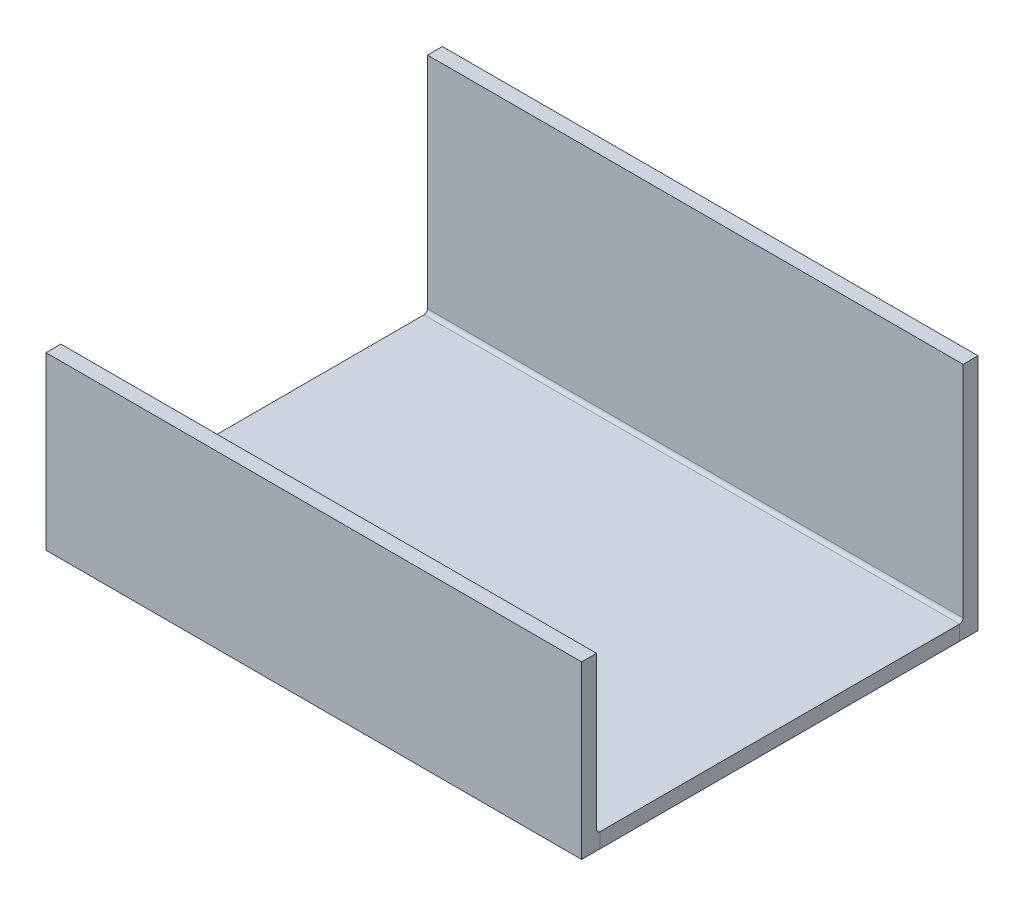
from build123d import *

# Parameters (mm, degrees)
SKETCH1_W                    = 114.3
SKETCH1_H                    = 78.232
BOSS_EXTRUDE1_DEPTH          = 3.175
EDGE_FLANGE1_STRIP_W         = 14.224
EDGE_FLANGE1_STRIP_H         = 3.175
EDGE_FLANGE1_STRIP_CUT_DEPTH = 114.3
EDGE_FLANGE1_DEPTH           = 114.3
EDGE_FLANGE2_STRIP_W         = 14.224
EDGE_FLANGE2_STRIP_H         = 3.175
EDGE_FLANGE2_STRIP_CUT_DEPTH = 114.3
EDGE_FLANGE2_DEPTH           = 114.3
SKETCH9_R                    = 2.667
CUT_EXTRUDE1_DEPTH           = 145.648316869
CHAMFER1_SIZE                = 3.175
SKETCH15_W                   = 114.3
SKETCH15_H                   = 36.5125
BOSS_EXTRUDE2_DEPTH          = 3.175
SKETCH16_W                   = 114.3
SKETCH16_H                   = 50.8
BOSS_EXTRUDE3_DEPTH          = 3.175


# Sheet-metal steps are written as plain solids
with BuildPart() as part:
    # Sketch1 → Boss-Extrude1 (new body)
    with BuildSketch(Plane(origin=(0, 0, 0), x_dir=(1, 0, 0), z_dir=(0, 1, 0))):
        with Locations((57.15, 39.116)):
            Rectangle(SKETCH1_W, SKETCH1_H)
    extrude(amount=BOSS_EXTRUDE1_DEPTH)

    # Edge-Flange1 strip (across the edge) → Edge-Flange1 strip cut (cut)
    with BuildSketch(Plane(origin=(114.3, 3.175, -78.232), x_dir=(0, 0, 1), z_dir=(-1, 0, 0))):
        with Locations((-6.35, -1.5875)):
            Rectangle(EDGE_FLANGE1_STRIP_W, EDGE_FLANGE1_STRIP_H)
    extrude(amount=EDGE_FLANGE1_STRIP_CUT_DEPTH, mode=Mode.SUBTRACT)

    # Edge-Flange1 section (across the edge) → Edge-Flange1 (add)
    with BuildSketch(Plane(origin=(114.3, 3.175, -78.232), x_dir=(0, 0, 1), z_dir=(-1, 0, 0))):
        with BuildLine():
            Line((-3.175, 0.762), (-3.175, 23.368))
            Line((-3.175, 23.368), (0, 23.368))
            Line((0, 23.368), (0, 0.762))
            ThreePointArc((0, 0.762), (0.223184633, 0.223184633), (0.762, 0))
            Line((0.762, 0), (0.762, -3.175))
            ThreePointArc((0.762, -3.175), (-2.021879398, -2.021879398), (-3.175, 0.762))
        make_face()
    extrude(amount=EDGE_FLANGE1_DEPTH)

    # Edge-Flange2 strip (across the edge) → Edge-Flange2 strip cut (cut)
    with BuildSketch(Plane(origin=(0, 3.175, 0), x_dir=(0, 0, -1), z_dir=(1, 0, 0))):
        with Locations((-6.35, -1.5875)):
            Rectangle(EDGE_FLANGE2_STRIP_W, EDGE_FLANGE2_STRIP_H)
    extrude(amount=EDGE_FLANGE2_STRIP_CUT_DEPTH, mode=Mode.SUBTRACT)

    # Edge-Flange2 section (across the edge) → Edge-Flange2 (add)
    with BuildSketch(Plane(origin=(0, 3.175, 0), x_dir=(0, 0, -1), z_dir=(1, 0, 0))):
        with BuildLine():
            Line((-3.175, 0.762), (-3.175, 23.368))
            Line((-3.175, 23.368), (0, 23.368))
            Line((0, 23.368), (0, 0.762))
            ThreePointArc((0, 0.762), (0.223184633, 0.223184633), (0.762, 0))
            Line((0.762, 0), (0.762, -3.175))
            ThreePointArc((0.762, -3.175), (-2.021879398, -2.021879398), (-3.175, 0.762))
        make_face()
    extrude(amount=EDGE_FLANGE2_DEPTH)

    # Sketch9 → Cut-Extrude1 (cut, through all)
    with BuildSketch(Plane.XY.offset(3.175)):
        with Locations((107.95, 16.637)):
            Circle(SKETCH9_R)
    extrude(amount=-CUT_EXTRUDE1_DEPTH, mode=Mode.SUBTRACT)

    # Chamfer1
    chamfer1_edges = [part.edges().sort_by_distance(p)[0] for p in [
        (114.3, 26.543, -79.8195),
        (0, 26.543, -79.8195),
        (0, 26.543, 1.5875),
        (114.3, 26.543, 1.5875),
    ]]
    chamfer(chamfer1_edges, length=CHAMFER1_SIZE)

    # Sketch15 → Boss-Extrude2 (add)
    with BuildSketch(Plane.XY.offset(3.175)):
        with Locations((57.15, 18.25625)):
            Rectangle(SKETCH15_W, SKETCH15_H)
    extrude(amount=-BOSS_EXTRUDE2_DEPTH)

    # Sketch16 → Boss-Extrude3 (add)
    with BuildSketch(Plane(origin=(0, 0, -81.407), x_dir=(-1, 0, 0), z_dir=(0, 0, -1))):
        with Locations((-57.15, 25.4)):
            Rectangle(SKETCH16_W, SKETCH16_H)
    extrude(amount=-BOSS_EXTRUDE3_DEPTH)


solid = part.part
